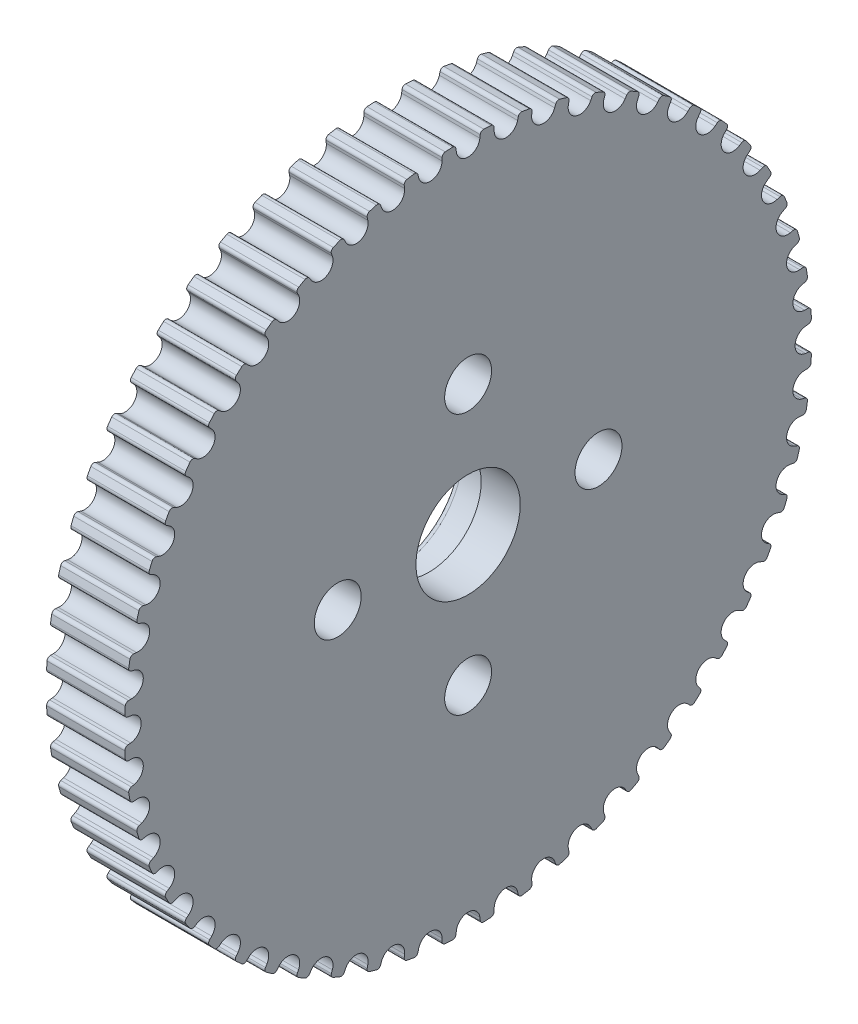
from build123d import *

# Parameters (mm, degrees)
CUT_EXTRUDE_2_REACH      = 39.757
PATTERN_CIRCULAR_3_COUNT = 56
SKETCH_7_R               = 4
CUT_EXTRUDE_3_DEPTH      = 10
SKETCH_8_R               = 5.05
CUT_EXTRUDE_4_DEPTH      = 3
SKETCH_9_R               = 1.8
CUT_EXTRUDE_5_DEPTH      = 10
FILLET_1_R               = 0.5
CHAMFER_1_SIZE           = 2.5


with BuildPart() as part:
    # 草图1 → 旋转1 (revolve)
    with BuildSketch(Plane.XY):
        Polygon((0, 5.2718), (0, 26.359), (6, 26.359), (6, 10.5436), (6, 0), (0, 0), align=None)
    revolve(axis=Axis((0, 0, 0), (1, 0, 0)))

    # 草图6 → 切除-拉伸2 (cut, up to next)
    with BuildSketch(Plane(origin=(0, 0, 0), x_dir=(0, 0, -1), z_dir=(1, 0, 0)), mode=Mode.PRIVATE) as cut_extrude_2_sk1:
        with BuildLine():
            Line((0.930903788, 26.103589707), (0.903216998, 25.878098898))
            ThreePointArc((0.903216998, 25.878098898), (0, 25.079), (-0.903216998, 25.878098898))
            Line((-0.903216998, 25.878098898), (-0.930903788, 26.103589707))
            ThreePointArc((-0.930903788, 26.103589707), (-1.021165973, 26.270506855), (-1.200810345, 26.331633742))
            ThreePointArc((-1.200810345, 26.331633742), (-1.330660773, 26.32539122), (-1.460478834, 26.318508365))
            Line((-1.460478834, 26.318508365), (-1.657126823, 27.920077708))
            ThreePointArc((-1.657126823, 27.920077708), (0, 27.969211796), (1.657126823, 27.920077708))
            Line((1.657126823, 27.920077708), (1.460478834, 26.318508365))
            ThreePointArc((1.460478834, 26.318508365), (1.330660773, 26.32539122), (1.200810345, 26.331633742))
            ThreePointArc((1.200810345, 26.331633742), (1.021165973, 26.270506855), (0.930903788, 26.103589707))
        make_face()
    cut_extrude_2_tool1 = extrude(cut_extrude_2_sk1.sketch, amount=CUT_EXTRUDE_2_REACH, mode=Mode.PRIVATE) & part.part
    cut_extrude_2 = cut_extrude_2_tool1.solids().sort_by_distance((0, 26.777178, 0))[0]
    add(cut_extrude_2, mode=Mode.SUBTRACT)

    # 阵列(圆周)3: 切除-拉伸2 ×56 about axis
    pattern_circular_3_axis = Axis((-0.45, 0, 0), (1, 0, 0))
    for i in range(1, PATTERN_CIRCULAR_3_COUNT):
        add(cut_extrude_2.rotate(pattern_circular_3_axis, i * 360 / PATTERN_CIRCULAR_3_COUNT), mode=Mode.SUBTRACT)

    # 草图7 → 切除-拉伸3 (cut)
    with BuildSketch(Plane(origin=(6, 0, 0), x_dir=(0, 0, -1), z_dir=(1, 0, 0))):
        Circle(SKETCH_7_R)
    extrude(amount=-CUT_EXTRUDE_3_DEPTH, mode=Mode.SUBTRACT)

    # 草图8 → 切除-拉伸4 (cut)
    with BuildSketch(Plane.ZY):
        Circle(SKETCH_8_R)
    extrude(amount=-CUT_EXTRUDE_4_DEPTH, mode=Mode.SUBTRACT)

    # 草图9 → 切除-拉伸5 (cut)
    with BuildSketch(Plane(origin=(6, 0, 0), x_dir=(0, 0, -1), z_dir=(1, 0, 0))):
        with Locations((0, 10)):
            Circle(SKETCH_9_R)
        with Locations((10, 0)):
            Circle(SKETCH_9_R)
        with Locations((0, -10)):
            Circle(SKETCH_9_R)
        with Locations((-10, 0)):
            Circle(SKETCH_9_R)
    extrude(amount=-CUT_EXTRUDE_5_DEPTH, mode=Mode.SUBTRACT)

    # 圆角1
    fillet_1_edges = [part.edges().sort_by_distance(p)[0] for p in [
        (0, 0, -5.05),
    ]]
    fillet(fillet_1_edges, radius=FILLET_1_R)

    # 倒角1
    chamfer_1_edges = [part.edges().sort_by_distance(p)[0] for p in [
        (0, 0, 11.8),
        (0, -10, 1.8),
        (0, 10, 1.8),
        (0, 0, -8.2),
    ]]
    chamfer(chamfer_1_edges, length=CHAMFER_1_SIZE)


solid = part.part
